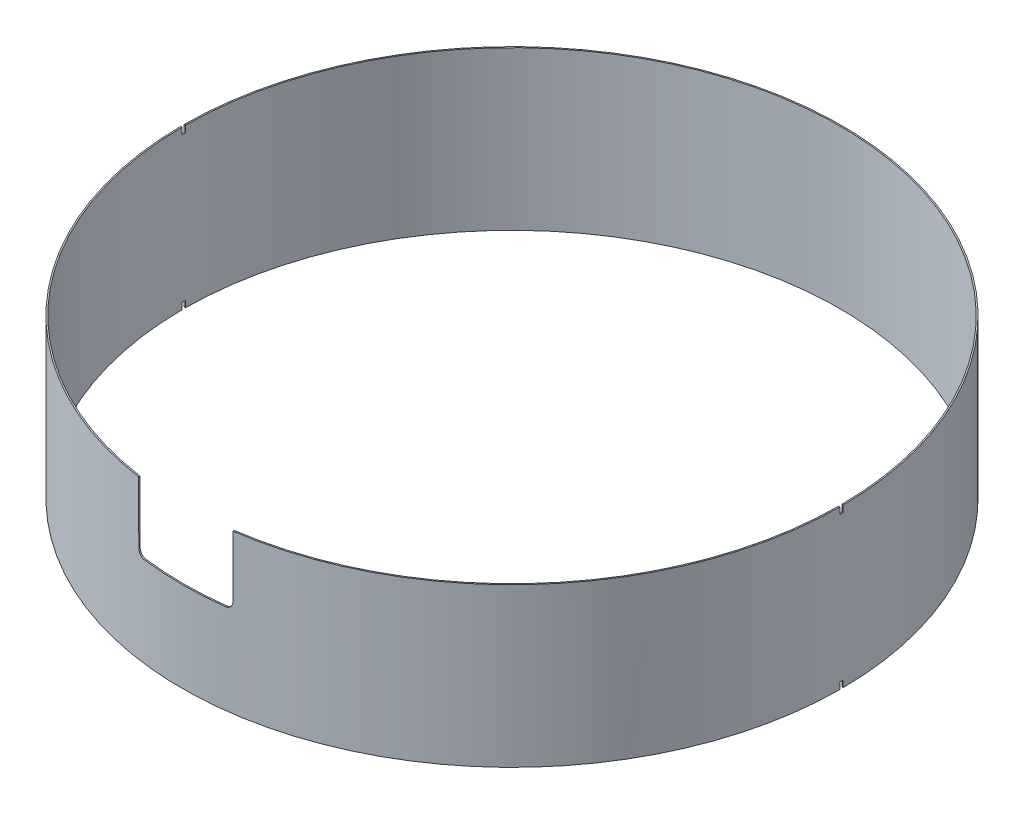
from build123d import *

# Parameters (mm, degrees)
SKETCH_1_R               = 50
SKETCH_1_R_2             = 49.8
EXTRUDE_1_DEPTH          = 24
CUT_EXTRUDE_1_DEPTH      = 52
CUT_EXTRUDE_2_DEPTH      = 52
CUT_EXTRUDE_2_DEPTH_BACK = 52
FILLET_1_R               = 1


with BuildPart() as part:
    # Эскиз1 → Бобышка-Вытянуть1 (new body)
    with BuildSketch(Plane(origin=(0, 0, 0), x_dir=(1, 0, 0), z_dir=(0, 1, 0))):
        Circle(SKETCH_1_R)
        Circle(SKETCH_1_R_2, mode=Mode.SUBTRACT)
    extrude(amount=EXTRUDE_1_DEPTH)

    # Эскиз2 → Вырез-Вытянуть1 (cut)
    with BuildSketch(Plane.XY):
        Polygon((-7.130200452, 13.65), (-7.158835795, 24), (7.158835795, 24), (7.130200452, 13.65), align=None)
    extrude(amount=CUT_EXTRUDE_1_DEPTH, mode=Mode.SUBTRACT)

    # Эскиз3 → Вырез-Вытянуть2 (cut, two sides: drawn at the far end of the back side and taken through both)
    with BuildSketch(Plane(origin=(0, 0, 0), x_dir=(0, 0, -1), z_dir=(1, 0, 0)).offset(-CUT_EXTRUDE_2_DEPTH_BACK)):
        Polygon((0, 24), (0.25, 24), (0.25, 23), (-0.25, 23), (-0.25, 24), align=None)
        Polygon((0.25, 1), (0.25, 0), (0, 0), (-0.25, 0), (-0.25, 1), align=None)
    extrude(amount=CUT_EXTRUDE_2_DEPTH + CUT_EXTRUDE_2_DEPTH_BACK, mode=Mode.SUBTRACT)

    # Скругление1
    fillet_1_edges = [part.edges().sort_by_distance(p)[0] for p in [
        (7.130200452, 13.65, 49.387954332),
        (-7.130200452, 13.65, 49.387954332),
    ]]
    fillet(fillet_1_edges, radius=FILLET_1_R)


solid = part.part
